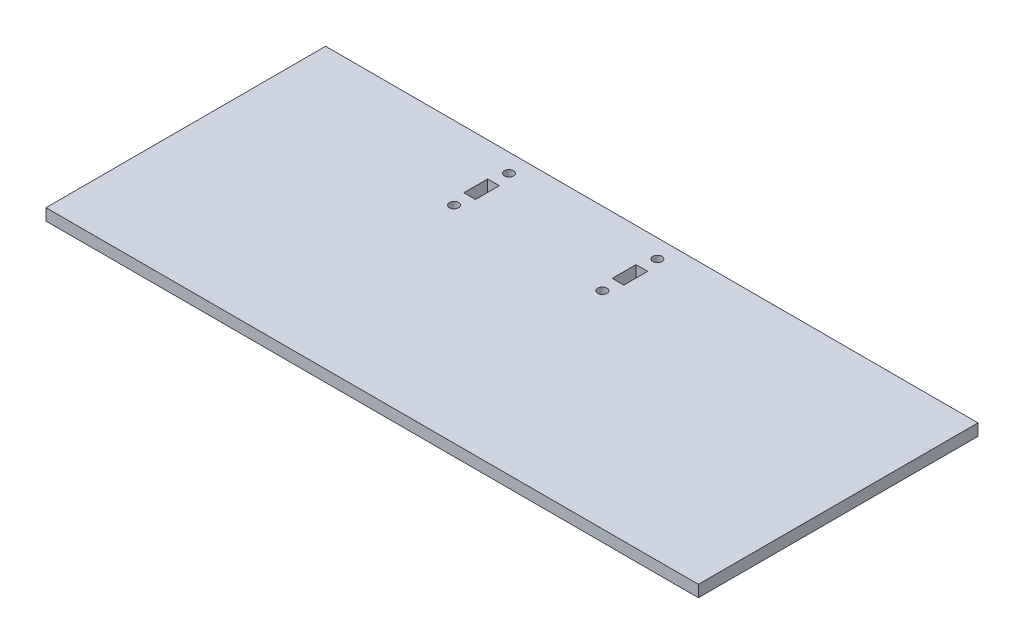
from build123d import *

# Parameters (mm, degrees)
SKETCH1_W           = 355.6
SKETCH1_H           = 152.4
SKETCH1_R           = 2.4892
SKETCH1_W_2         = 6.35
SKETCH1_H_2         = 13
BOSS_EXTRUDE1_DEPTH = 6.35


with BuildPart() as part:
    # Sketch1 → Boss-Extrude1 (new body)
    with BuildSketch(Plane(origin=(0, 0, 0), x_dir=(1, 0, 0), z_dir=(0, 1, 0))):
        with Locations((177.8, 76.2)):
            Rectangle(SKETCH1_W, SKETCH1_H)
        with Locations((110.000007, 142.399999934)):
            Circle(SKETCH1_R, mode=Mode.SUBTRACT)
        with Locations((190.860007, 142.399999934)):
            Circle(SKETCH1_R, mode=Mode.SUBTRACT)
        with Locations((110.000007, 112.39999999)):
            Circle(SKETCH1_R, mode=Mode.SUBTRACT)
        with Locations((190.860007, 112.39999999)):
            Circle(SKETCH1_R, mode=Mode.SUBTRACT)
        with Locations((110.000007, 127.399999934)):
            Rectangle(SKETCH1_W_2, SKETCH1_H_2, mode=Mode.SUBTRACT)
        with Locations((190.860007, 127.399999934)):
            Rectangle(SKETCH1_W_2, SKETCH1_H_2, mode=Mode.SUBTRACT)
    extrude(amount=BOSS_EXTRUDE1_DEPTH)


solid = part.part
